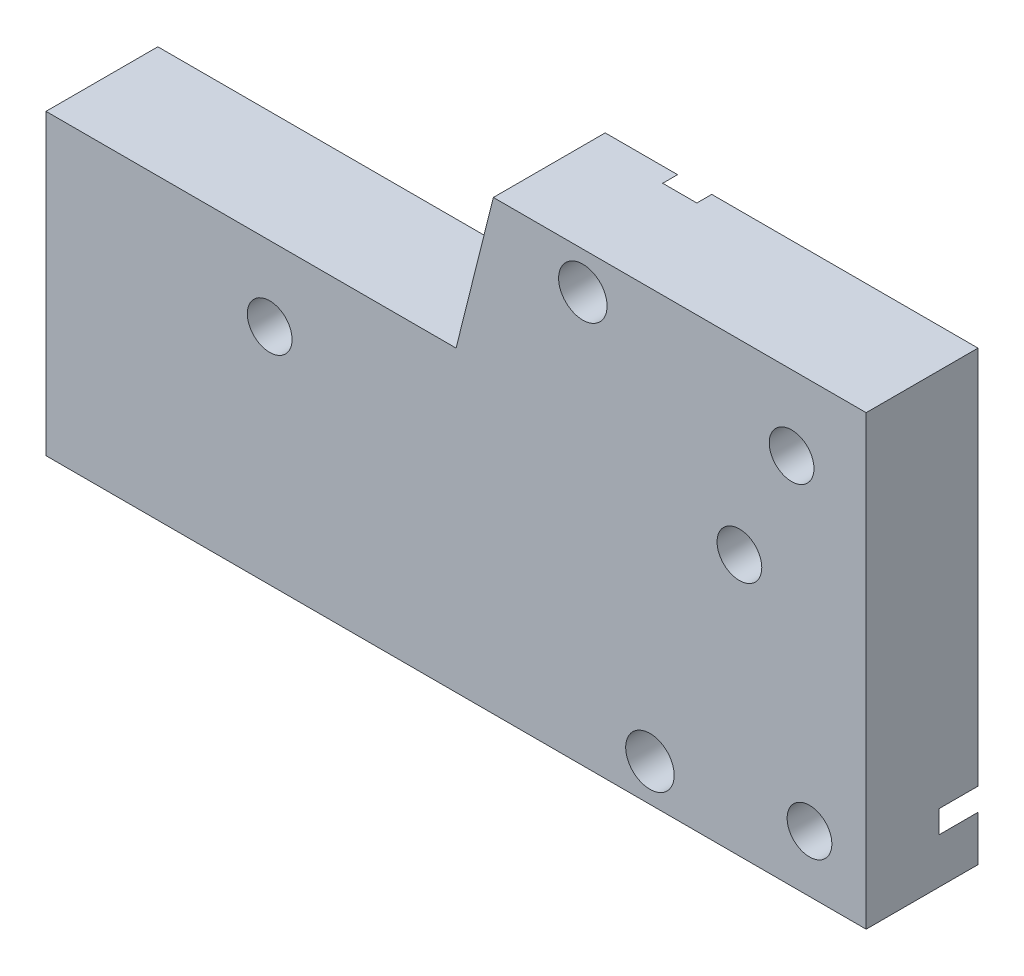
from build123d import *

# Parameters (mm, degrees)
BOSS_EXTRUDE1_DEPTH     = 15
SKETCH1_4_R             = 3
CUT_EXTRUDE1_DEPTH      = 15
SKETCH1_5_R             = 3
CUT_EXTRUDE2_DEPTH      = 15
SKETCH2_R               = 7.75
CUT_EXTRUDE3_DEPTH      = 5.2
CUT_EXTRUDE4_DEPTH      = 127.194294641
CUT_EXTRUDE4_DEPTH_BACK = 127.194294641
SKETCH1_6_R             = 3.25
SKETCH3_R               = 5.5
CUT_EXTRUDE13_DEPTH     = 2


with BuildPart() as part:
    # Sketch1 → Boss-Extrude1 (new body)
    with BuildSketch(Plane.XY):
        Polygon((0, 0), (110, 0), (110, 60), (60, 60), (55, 40), (0, 40), align=None)
    extrude(amount=-BOSS_EXTRUDE1_DEPTH)

    # Sketch1<4> → Cut-Extrude1 (cut)
    with BuildSketch(Plane.XY):
        with Locations((93, 35)):
            Circle(SKETCH1_4_R)
        with Locations((30, 30)):
            Circle(SKETCH1_4_R)
    extrude(amount=-CUT_EXTRUDE1_DEPTH, mode=Mode.SUBTRACT)

    # Sketch1<5> → Cut-Extrude2 (cut)
    with BuildSketch(Plane.XY):
        with Locations((100, 50)):
            Circle(SKETCH1_5_R)
        with Locations((102.4, 7.6)):
            Circle(SKETCH1_5_R)
    extrude(amount=-CUT_EXTRUDE2_DEPTH, mode=Mode.SUBTRACT)

    # Sketch2 → Cut-Extrude3 (cut)
    with BuildSketch(Plane(origin=(0, 0, -15), x_dir=(-1, 0, 0), z_dir=(0, 0, -1))):
        with Locations((-100, 50)):
            Circle(SKETCH2_R)
        with Locations((-93, 35)):
            Circle(SKETCH2_R)
        with Locations((-102.4, 7.6)):
            Circle(SKETCH2_R)
        with Locations((-30, 30)):
            Circle(SKETCH2_R)
    extrude(amount=-CUT_EXTRUDE3_DEPTH, mode=Mode.SUBTRACT)

    # Sketch1<6> → Cut-Extrude4 (cut, two sides: drawn at the far end of the back side and taken through both)
    with BuildSketch(Plane.XY.offset(-CUT_EXTRUDE4_DEPTH_BACK)):
        with Locations((72, 55)):
            Circle(SKETCH1_6_R)
        with Locations((81, 5)):
            Circle(SKETCH1_6_R)
    extrude(amount=CUT_EXTRUDE4_DEPTH + CUT_EXTRUDE4_DEPTH_BACK, mode=Mode.SUBTRACT)

    # Sketch3 → Cut-Extrude13 (cut)
    with BuildSketch(Plane(origin=(0, 0, -15), x_dir=(-1, 0, 0), z_dir=(0, 0, -1))):
        with Locations((-72, 55)):
            Circle(SKETCH3_R)
        with Locations((-81, 5)):
            Circle(SKETCH3_R)
    extrude(amount=-CUT_EXTRUDE13_DEPTH, mode=Mode.SUBTRACT)


solid = part.part
